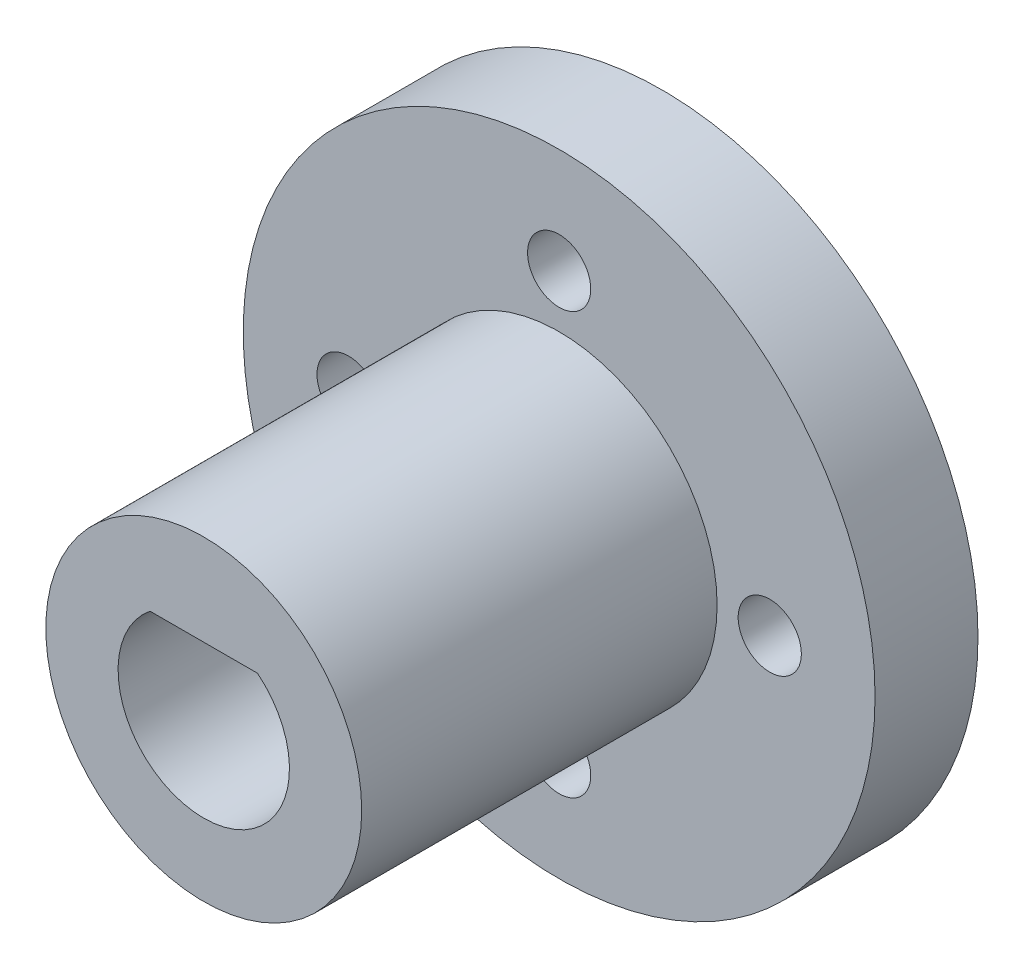
from build123d import *

# Parameters (mm, degrees)
ESQUISSE1_R                  = 12
BOSS_EXTRU_1_DEPTH           = 3.91
ESQUISSE6_R                  = 4.15
ENL_V_MAT_EXTRU_2_DEPTH      = 2.5
ESQUISSE7_R                  = 6
BOSS_EXTRU_2_DEPTH           = 13.5
D_GAGEMENT_M21_D             = 2.4
R_P_TITION_CIRCULAIRE2_COUNT = 4


with BuildPart() as part:
    # Esquisse1 → Boss.-Extru.1 (new body)
    with BuildSketch(Plane.XY):
        Circle(ESQUISSE1_R)
    extrude(amount=BOSS_EXTRU_1_DEPTH)

    # Esquisse6 → Enlèv. mat.-Extru.2 (cut)
    with BuildSketch(Plane(origin=(0, 0, 0), x_dir=(-1, 0, 0), z_dir=(0, 0, -1))):
        Circle(ESQUISSE6_R)
    extrude(amount=-ENL_V_MAT_EXTRU_2_DEPTH, mode=Mode.SUBTRACT)

    # Esquisse7 → Boss.-Extru.2 (add)
    with BuildSketch(Plane.XY.offset(3.91)):
        Circle(ESQUISSE7_R)
        with BuildLine():
            Line((-2.041763943, 2.535), (2.041763943, 2.535))
            ThreePointArc((2.041763943, 2.535), (0, -3.255), (-2.041763943, 2.535))
        make_face(mode=Mode.SUBTRACT)
    extrude(amount=BOSS_EXTRU_2_DEPTH)

    # Dégagement M21 (through all)
    with Locations(Plane.XY.offset(3.91)):
        with Locations((0, 8)):
            d_gagement_m21 = Hole(D_GAGEMENT_M21_D / 2)

    # Répétition circulaire2: Dégagement M21 ×4 about axis
    r_p_tition_circulaire2_axis = Axis((0, 0, 3.91), (0, 0, 1))
    for i in range(1, R_P_TITION_CIRCULAIRE2_COUNT):
        add(d_gagement_m21.rotate(r_p_tition_circulaire2_axis, i * 360 / R_P_TITION_CIRCULAIRE2_COUNT), mode=Mode.SUBTRACT)


solid = part.part
